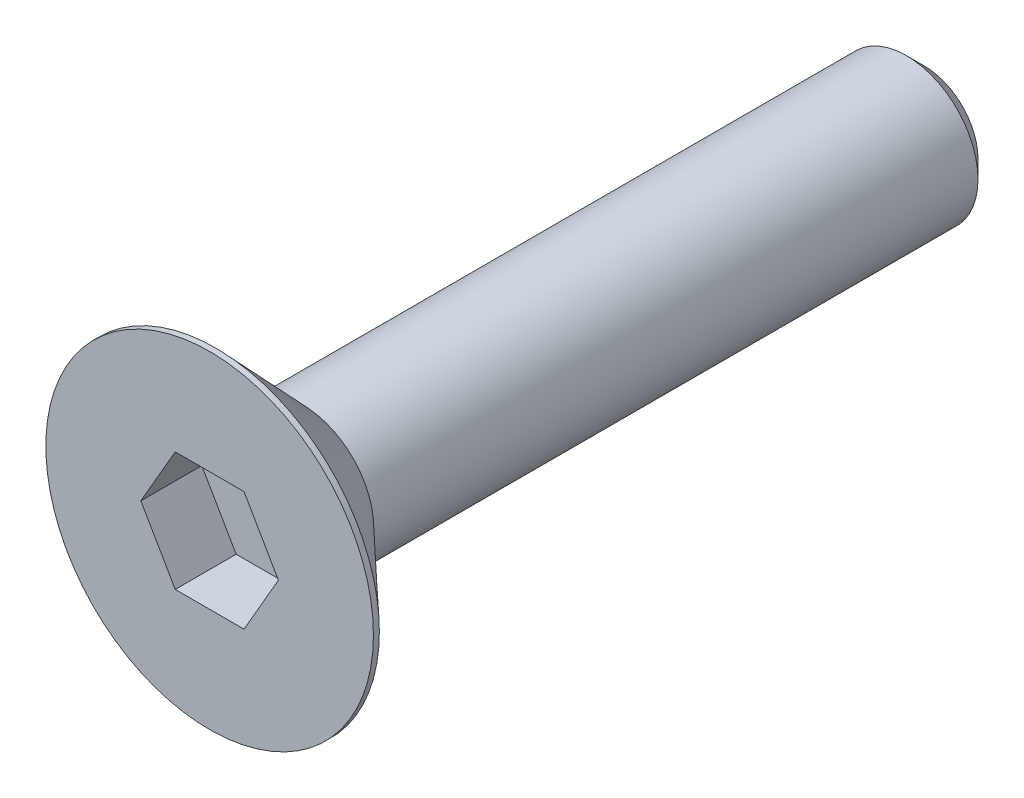
from build123d import *

# Parameters (mm, degrees)
SHANK_TIP_CHAMFER_SIZE          = 0.3
COUNTERSUNK_HEAD_CHAMFER_SIZE   = 1.65
COUNTERSUNK_HEAD_CHAMFER_SIZE_2 = 1.55
HEX_DRIVE_CUT_DEPTH             = 1.023


with BuildPart() as part:
    # Screw Section → Screw Blank Revolve (revolve)
    with BuildSketch(Plane(origin=(0, 0, 0), x_dir=(1, 0, 0), z_dir=(0, 1, 0))):
        Polygon((0, 12), (1.2, 12), (1.2, 1.65), (2.75, 1.65), (2.75, 0), (0, 0), align=None)
    revolve(axis=Axis((0, 0, 10.123), (0, 0, -1)))

    # Shank Tip Chamfer
    shank_tip_chamfer_edges = [part.edges().sort_by_distance(p)[0] for p in [
        (-1.2, 0, -12),
    ]]
    chamfer(shank_tip_chamfer_edges, length=SHANK_TIP_CHAMFER_SIZE)

    # Countersunk Head Chamfer
    # the kernel refuses this chamfer: 1.65, 1.55 mm, written as the material it takes off along each edge
    with BuildSketch(Plane(origin=(0, 0, -1.65), x_dir=(1, 0, 0), z_dir=(0, 1, 0))) as countersunk_head_chamfer_piece_1_section:
        Polygon((2.75 - COUNTERSUNK_HEAD_CHAMFER_SIZE, 0), (2.75, -COUNTERSUNK_HEAD_CHAMFER_SIZE_2), (2.75, 0), align=None)
    countersunk_head_chamfer_piece_1 = revolve(axis=Axis((0, 0, -1.65), (0, 0, -1)), mode=Mode.PRIVATE)
    countersunk_head_chamfer_piece_1 = countersunk_head_chamfer_piece_1 - Plane(origin=(0, 0, -0.825037094), x_dir=(1, 0, 0), z_dir=(0, 0, 1)) * Cylinder(1.2, 11, mode=Mode.PRIVATE)
    add(countersunk_head_chamfer_piece_1, mode=Mode.SUBTRACT)

    # Hex Drive Sketch → Hex Drive Cut (cut)
    with BuildSketch(Plane.XY):
        Polygon((1.154700538, 0), (0.577350269, 1), (-0.577350269, 1), (-1.154700538, 0), (-0.577350269, -1), (0.577350269, -1), align=None)
    extrude(amount=-HEX_DRIVE_CUT_DEPTH, mode=Mode.SUBTRACT)


solid = part.part
